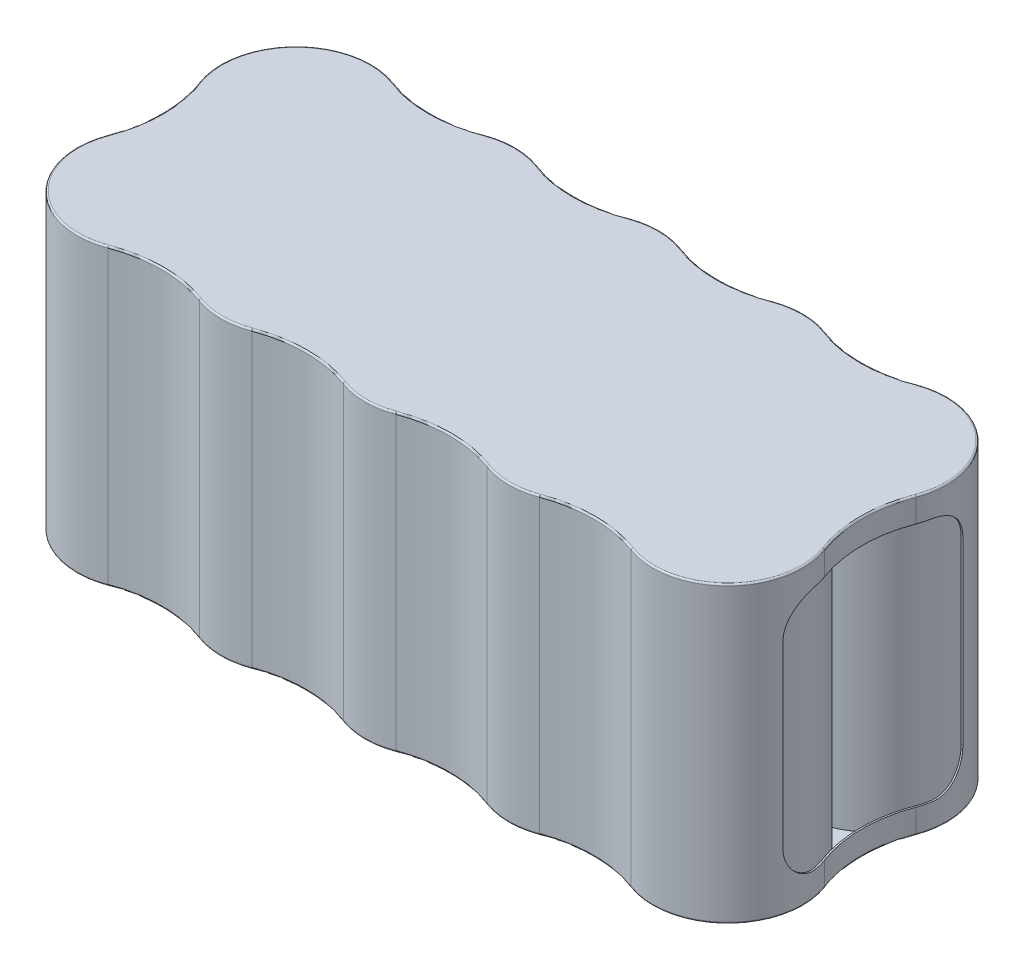
from build123d import *
from build123d.topology import SkipClean

# Parameters (mm, degrees)
SKETCH1_R                        = 11.25
BATTERY_CELL_DEPTH               = 21.5
CELL_PATTERN_COUNT               = 5
CELL_PATTERN_PITCH               = 22
CELL_PATTERN_COUNT_DIR2          = 2
CELL_PATTERN_PITCH_DIR2          = 22
HEAT_SHRINK_DEPTH                = 22.5
HEAT_SHRINK_FILLETS_DEPTH        = 115.225653861
HEAT_START                       = -22.25
HEAT_SHRINK_SHELL_DEPTH          = 44.5
HEAT_SHRINK_END_HOLES_DEPTH      = 108.372016964
HEAT_SHRINK_END_HOLES_DEPTH_BACK = 108.372016964
FILLET1_R                        = 0.25


# Read off the part's stored shape, not the designer's step: Heat Shrink Shell
with BuildPart() as part:
    # Sketch1 → Battery Cell (new, symmetric)
    with BuildSketch(Plane(origin=(0, 0, 0), x_dir=(1, 0, 0), z_dir=(0, 1, 0))):
        with Locations(Location((0, 0, 0), (0, 0, 270))):
            Circle(SKETCH1_R)
    battery_cell = extrude(amount=BATTERY_CELL_DEPTH, both=True)

    # Cell Pattern: Battery Cell 5 × 2
    with Locations(*[(i * CELL_PATTERN_PITCH, 0, -j * CELL_PATTERN_PITCH_DIR2) for i in range(CELL_PATTERN_COUNT) for j in range(CELL_PATTERN_COUNT_DIR2) if (i, j) != (0, 0)]):
        add(battery_cell)


with BuildPart() as body_2:
    # Sketch3 → Heat Shrink (new, symmetric)
    with BuildSketch(Plane(origin=(0, 0, 0), x_dir=(1, 0, 0), z_dir=(0, 1, 0))):
        with BuildLine():
            Line((0, 33.5), (88, 33.5))
            ThreePointArc((88, 33.5), (96.131727984, 30.131727984), (99.5, 22))
            Line((99.5, 22), (99.5, 0))
            ThreePointArc((99.5, 0), (96.131727984, -8.131727984), (88, -11.5))
            Line((88, -11.5), (0, -11.5))
            ThreePointArc((0, -11.5), (-8.131727984, -8.131727984), (-11.5, 0))
            Line((-11.5, 0), (-11.5, 22))
            ThreePointArc((-11.5, 22), (-8.131727984, 30.131727984), (0, 33.5))
        make_face()
    extrude(amount=HEAT_SHRINK_DEPTH, both=True)

    # Sketch4 → Heat Shrink Fillets (cut, through all)
    with SkipClean():  # the faces are left unmerged after this step: merging them gives an invalid solid
        with BuildSketch(Plane(origin=(0, 22.5, 0), x_dir=(1, 0, 0), z_dir=(0, 1, 0))):
            with BuildLine():
                ThreePointArc((-20.146485783, 7.507936508), (-15.202795796, -15.202795796), (7.507936508, -20.146485783))
                ThreePointArc((7.507936508, -20.146485783), (11, -19.516944286), (14.492063492, -20.146485783))
                ThreePointArc((14.492063492, -20.146485783), (22, -21.5), (29.507936508, -20.146485783))
                ThreePointArc((29.507936508, -20.146485783), (33, -19.516944286), (36.492063492, -20.146485783))
                ThreePointArc((36.492063492, -20.146485783), (44, -21.5), (51.507936508, -20.146485783))
                ThreePointArc((51.507936508, -20.146485783), (55, -19.516944286), (58.492063492, -20.146485783))
                ThreePointArc((58.492063492, -20.146485783), (66, -21.5), (73.507936508, -20.146485783))
                ThreePointArc((73.507936508, -20.146485783), (77, -19.516944286), (80.492063492, -20.146485783))
                ThreePointArc((80.492063492, -20.146485783), (103.202795796, -15.202795796), (108.146485783, 7.507936508))
                ThreePointArc((108.146485783, 7.507936508), (107.516944286, 11), (108.146485783, 14.492063492))
                ThreePointArc((108.146485783, 14.492063492), (103.202795796, 37.202795796), (80.492063492, 42.146485783))
                ThreePointArc((80.492063492, 42.146485783), (77, 41.516944286), (73.507936508, 42.146485783))
                ThreePointArc((73.507936508, 42.146485783), (66, 43.5), (58.492063492, 42.146485783))
                ThreePointArc((58.492063492, 42.146485783), (55, 41.516944286), (51.507936508, 42.146485783))
                ThreePointArc((51.507936508, 42.146485783), (44, 43.5), (36.492063492, 42.146485783))
                ThreePointArc((36.492063492, 42.146485783), (33, 41.516944286), (29.507936508, 42.146485783))
                ThreePointArc((29.507936508, 42.146485783), (22, 43.5), (14.492063492, 42.146485783))
                ThreePointArc((14.492063492, 42.146485783), (11, 41.516944286), (7.507936508, 42.146485783))
                ThreePointArc((7.507936508, 42.146485783), (-15.202795796, 37.202795796), (-20.146485783, 14.492063492))
                ThreePointArc((-20.146485783, 14.492063492), (-19.516944286, 11), (-20.146485783, 7.507936508))
            make_face()
            with BuildLine():
                ThreePointArc((-10.776027279, 4.015873016), (-8.131727984, -8.131727984), (4.015873016, -10.776027279))
                ThreePointArc((4.015873016, -10.776027279), (11, -9.516944286), (17.984126984, -10.776027279))
                ThreePointArc((17.984126984, -10.776027279), (22, -11.5), (26.015873016, -10.776027279))
                ThreePointArc((26.015873016, -10.776027279), (33, -9.516944286), (39.984126984, -10.776027279))
                ThreePointArc((39.984126984, -10.776027279), (44, -11.5), (48.015873016, -10.776027279))
                ThreePointArc((48.015873016, -10.776027279), (55, -9.516944286), (61.984126984, -10.776027279))
                ThreePointArc((61.984126984, -10.776027279), (66, -11.5), (70.015873016, -10.776027279))
                ThreePointArc((70.015873016, -10.776027279), (77, -9.516944286), (83.984126984, -10.776027279))
                ThreePointArc((83.984126984, -10.776027279), (96.131727984, -8.131727984), (98.776027279, 4.015873016))
                ThreePointArc((98.776027279, 4.015873016), (97.516944286, 11), (98.776027279, 17.984126984))
                ThreePointArc((98.776027279, 17.984126984), (96.131727984, 30.131727984), (83.984126984, 32.776027279))
                ThreePointArc((83.984126984, 32.776027279), (77, 31.516944286), (70.015873016, 32.776027279))
                ThreePointArc((70.015873016, 32.776027279), (66, 33.5), (61.984126984, 32.776027279))
                ThreePointArc((61.984126984, 32.776027279), (55, 31.516944286), (48.015873016, 32.776027279))
                ThreePointArc((48.015873016, 32.776027279), (44, 33.5), (39.984126984, 32.776027279))
                ThreePointArc((39.984126984, 32.776027279), (33, 31.516944286), (26.015873016, 32.776027279))
                ThreePointArc((26.015873016, 32.776027279), (22, 33.5), (17.984126984, 32.776027279))
                ThreePointArc((17.984126984, 32.776027279), (11, 31.516944286), (4.015873016, 32.776027279))
                ThreePointArc((4.015873016, 32.776027279), (-8.131727984, 30.131727984), (-10.776027279, 17.984126984))
                ThreePointArc((-10.776027279, 17.984126984), (-9.516944286, 11), (-10.776027279, 4.015873016))
            make_face(mode=Mode.SUBTRACT)
        extrude(amount=-HEAT_SHRINK_FILLETS_DEPTH, mode=Mode.SUBTRACT)

    # Heat Shrink Shell outline → Heat Shrink Shell (cut)
    with SkipClean():  # the faces are left unmerged after this step: merging them gives an invalid solid
        with BuildSketch(Plane(origin=(0, 0, 0), x_dir=(1, 0, 0), z_dir=(0, 1, 0)).offset(HEAT_START)):
            with BuildLine():
                ThreePointArc((-10.541765817, 3.928571429), (-7.954951288, -7.954951288), (3.928571429, -10.541765817))
                ThreePointArc((3.928571429, -10.541765817), (11, -9.266944286), (18.071428571, -10.541765817))
                ThreePointArc((18.071428571, -10.541765817), (22, -11.25), (25.928571429, -10.541765817))
                ThreePointArc((25.928571429, -10.541765817), (33, -9.266944286), (40.071428571, -10.541765817))
                ThreePointArc((40.071428571, -10.541765817), (44, -11.25), (47.928571429, -10.541765817))
                ThreePointArc((47.928571429, -10.541765817), (55, -9.266944286), (62.071428571, -10.541765817))
                ThreePointArc((62.071428571, -10.541765817), (66, -11.25), (69.928571429, -10.541765817))
                ThreePointArc((69.928571429, -10.541765817), (77, -9.266944286), (84.071428571, -10.541765817))
                ThreePointArc((84.071428571, -10.541765817), (95.954951288, -7.954951288), (98.541765817, 3.928571429))
                ThreePointArc((98.541765817, 3.928571429), (97.266944286, 11), (98.541765817, 18.071428571))
                ThreePointArc((98.541765817, 18.071428571), (95.954951288, 29.954951288), (84.071428571, 32.541765817))
                ThreePointArc((84.071428571, 32.541765817), (77, 31.266944286), (69.928571429, 32.541765817))
                ThreePointArc((69.928571429, 32.541765817), (66, 33.25), (62.071428571, 32.541765817))
                ThreePointArc((62.071428571, 32.541765817), (55, 31.266944286), (47.928571429, 32.541765817))
                ThreePointArc((47.928571429, 32.541765817), (44, 33.25), (40.071428571, 32.541765817))
                ThreePointArc((40.071428571, 32.541765817), (33, 31.266944286), (25.928571429, 32.541765817))
                ThreePointArc((25.928571429, 32.541765817), (22, 33.25), (18.071428571, 32.541765817))
                ThreePointArc((18.071428571, 32.541765817), (11, 31.266944286), (3.928571429, 32.541765817))
                ThreePointArc((3.928571429, 32.541765817), (-7.954951288, 29.954951288), (-10.541765817, 18.071428571))
                ThreePointArc((-10.541765817, 18.071428571), (-9.266944286, 11), (-10.541765817, 3.928571429))
            make_face()
        extrude(amount=HEAT_SHRINK_SHELL_DEPTH, mode=Mode.SUBTRACT)

    # Sketch5 → Heat Shrink End Holes (cut, two sides: drawn at the far end of the back side and taken through both)
    with SkipClean():  # the faces are left unmerged after this step: merging them gives an invalid solid
        with BuildSketch(Plane(origin=(0, 0, 0), x_dir=(0, 0, -1), z_dir=(1, 0, 0)).offset(-HEAT_SHRINK_END_HOLES_DEPTH_BACK)):
            with BuildLine():
                Line((2.25, 18.75), (19.75, 18.75))
                ThreePointArc((19.75, 18.75), (23.285533906, 17.285533906), (24.75, 13.75))
                Line((24.75, 13.75), (24.75, -13.75))
                ThreePointArc((24.75, -13.75), (23.285533906, -17.285533906), (19.75, -18.75))
                Line((19.75, -18.75), (2.25, -18.75))
                ThreePointArc((2.25, -18.75), (-1.285533906, -17.285533906), (-2.75, -13.75))
                Line((-2.75, -13.75), (-2.75, 13.75))
                ThreePointArc((-2.75, 13.75), (-1.285533906, 17.285533906), (2.25, 18.75))
            make_face()
        extrude(amount=HEAT_SHRINK_END_HOLES_DEPTH + HEAT_SHRINK_END_HOLES_DEPTH_BACK, mode=Mode.SUBTRACT)

    # Fillet1
    fillet1_edges = [body_2.edges().sort_by_distance(p)[0] for p in [
        (96.131727984, -22.5, 8.131727984),
        (-8.131727984, -22.5, 8.131727984),
        (96.131727984, 22.5, 8.131727984),
        (96.131727984, 22.5, -30.131727984),
        (19.95969533, -22.5, 11.317559669),
        (-8.131727984, 22.5, -30.131727984),
        (41.95969533, -22.5, 11.317559669),
        (63.95969533, -22.5, 11.317559669),
        (63.95969533, -22.5, -33.317559669),
        (41.95969533, -22.5, -33.317559669),
        (24.04030467, -22.5, -33.317559669),
        (-8.131727984, 22.5, 8.131727984),
        (77, -22.5, 9.516944286),
        (55, -22.5, 9.516944286),
        (33, -22.5, 9.516944286),
        (11, -22.5, 9.516944286),
        (97.516944286, -22.5, -11),
        (11, -22.5, -31.516944286),
        (33, -22.5, -31.516944286),
        (55, -22.5, -31.516944286),
        (77, -22.5, -31.516944286),
        (-9.516944286, -22.5, -11),
        (24.04030467, 22.5, -33.317559669),
        (46.04030467, 22.5, -33.317559669),
        (63.95969533, 22.5, -33.317559669),
        (68.040304666, 22.5, 11.317559669),
        (46.04030467, 22.5, 11.317559669),
        (19.959695389, 22.5, 11.317559679),
        (11, 22.5, 9.516944286),
        (-9.516944286, 22.5, -11),
        (11, 22.5, -31.516944286),
        (33, 22.5, -31.516944286),
        (55, 22.5, -31.516944286),
        (77, 22.5, -31.516944286),
        (97.516944286, 22.5, -11),
        (77, 22.5, 9.516944286),
        (-8.131727984, -22.5, -30.131727984),
        (55, 22.5, 9.516944286),
        (33, 22.5, 9.516944286),
        (96.131727984, -22.5, -30.131727984),
    ]]
    fillet(fillet1_edges, radius=FILLET1_R)


solid = Compound([part.part, body_2.part])
